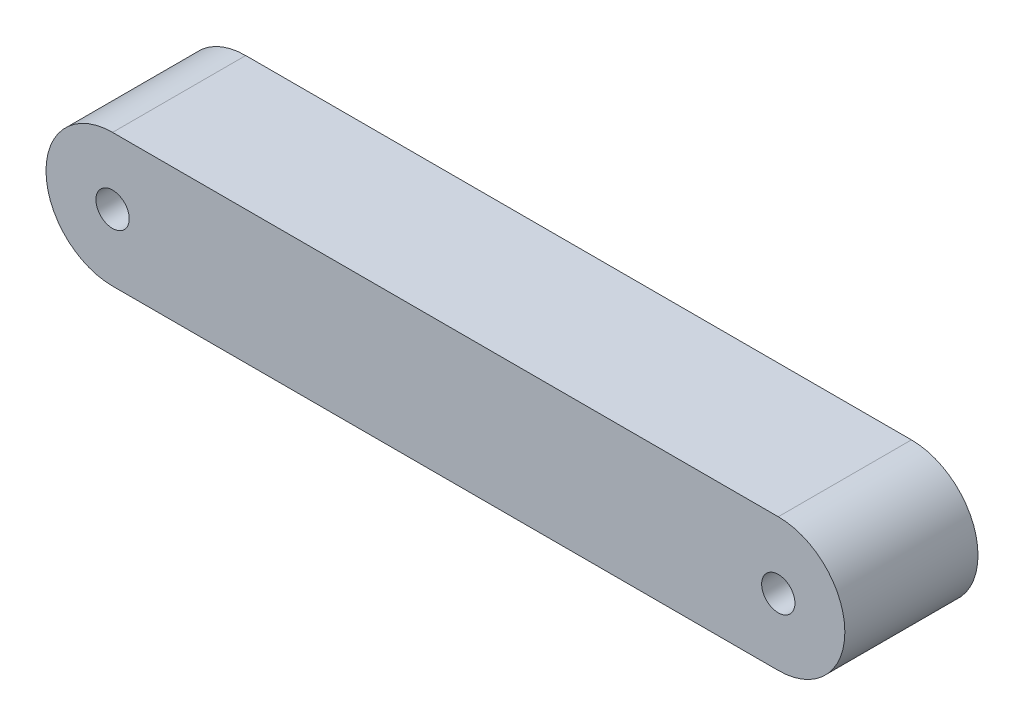
from build123d import *

# Parameters (mm, degrees)
SKETCH_1_R      = 0.5
EXTRUDE_1_DEPTH = 4


with BuildPart() as part:
    # 草图1 → 凸台-拉伸1 (new body)
    with BuildSketch(Plane.XY):
        with BuildLine():
            Line((0, 2), (20, 2))
            ThreePointArc((20, 2), (22, 0), (20, -2))
            Line((20, -2), (0, -2))
            ThreePointArc((0, -2), (-2, 0), (0, 2))
        make_face()
        Circle(SKETCH_1_R, mode=Mode.SUBTRACT)
        with Locations((20, 0)):
            Circle(SKETCH_1_R, mode=Mode.SUBTRACT)
    extrude(amount=EXTRUDE_1_DEPTH)


solid = part.part
